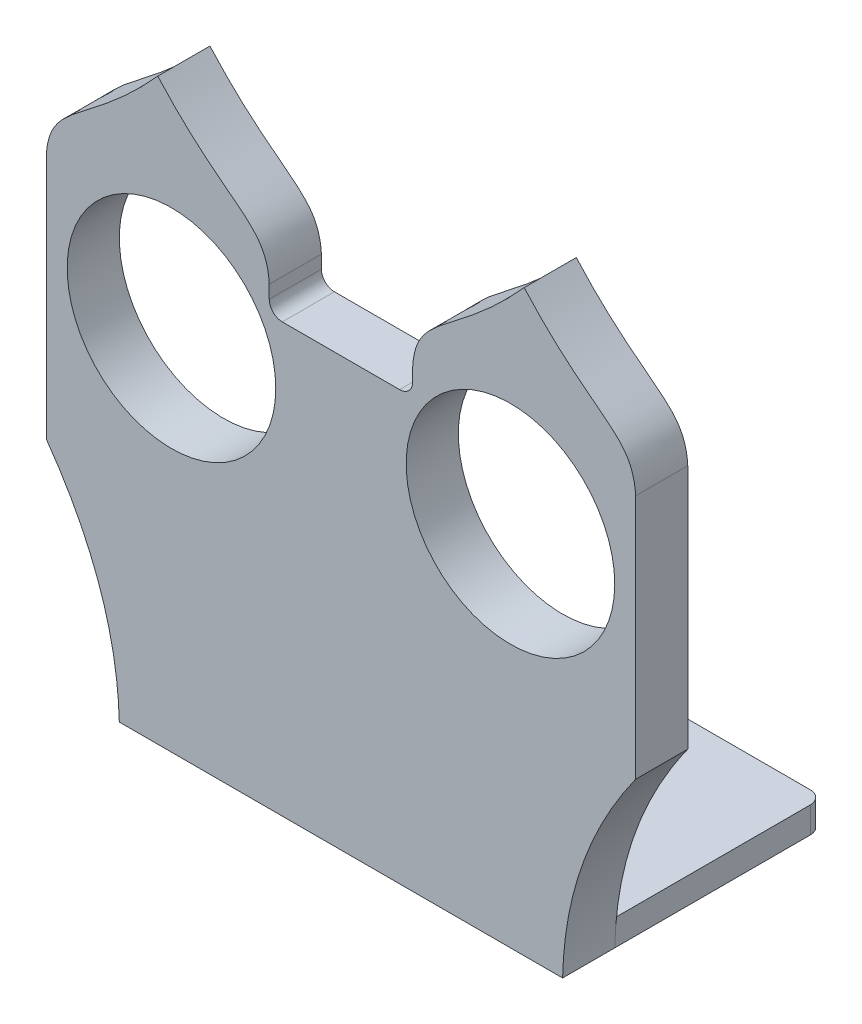
from build123d import *

# Parameters (mm, degrees)
SKETCH_1_R           = 8
EXTRUDE_2_DEPTH      = 2
EXTRUDE_3_DEPTH      = 18
EXTRUDE_3_DEPTH_BACK = 1
SKETCH_2_W           = 45.2
SKETCH_2_H           = 2
SKETCH_3_W           = 45.2
SKETCH_3_H           = 18
EXTRUDE_4_DEPTH      = 18
SKETCH_4_W           = 45.2
SKETCH_4_H           = 18
CUT_EXTRUDE_2_DEPTH  = 16
CUT_EXTRUDE_4_DEPTH  = 20
SKETCH_7_W           = 0.117046
SKETCH_7_H           = 18
CUT_EXTRUDE_5_DEPTH  = 20
CUT_EXTRUDE_6_DEPTH  = 20
SKETCH_9_R           = 0.5
CUT_EXTRUDE_7_DEPTH  = 20
CUT_EXTRUDE_8_DEPTH  = 20
FILLET_1_R           = 1
FILLET_2_R           = 1
FILLET_3_R           = 1
SKETCH_14_W          = 47.954779
SKETCH_14_H          = 7.292093
CUT_EXTRUDE_12_DEPTH = 4
EXTRUDE_START        = -4
EXTRUDE_11_OUTLINE_R = 8
EXTRUDE_11_DEPTH     = 4


# Read off the part's stored shape, not the designer's step: 凸台-拉伸11
with BuildPart() as part:
    # 草图1 → 凸台-拉伸2 (new body)
    with BuildSketch(Plane.XY):
        with BuildLine():
            Line((1, 0), (44.2, 0))
            ThreePointArc((44.2, 0), (44.907107, 0.292893), (45.2, 1))
            Line((45.2, 1), (45.2, 19.33))
            ThreePointArc((45.2, 19.33), (44.907107, 20.037107), (44.2, 20.33))
            Line((44.2, 20.33), (1, 20.33))
            ThreePointArc((1, 20.33), (0.292893, 20.037107), (0, 19.33))
            Line((0, 19.33), (0, 1))
            ThreePointArc((0, 1), (0.292893, 0.292893), (1, 0))
        make_face()
        with Locations((35.6, 10.165)):
            Circle(SKETCH_1_R, mode=Mode.SUBTRACT)
        with Locations((9.6, 10.165)):
            Circle(SKETCH_1_R, mode=Mode.SUBTRACT)
    extrude(amount=EXTRUDE_2_DEPTH)

    # 草图2 → 凸台-拉伸3 (add, two sides: drawn at the far end of the back side and taken through both)
    with BuildSketch(Plane.XZ.offset(-EXTRUDE_3_DEPTH_BACK)):
        with Locations((22.6, 1)):
            Rectangle(SKETCH_2_W, SKETCH_2_H)
    extrude(amount=EXTRUDE_3_DEPTH + EXTRUDE_3_DEPTH_BACK)

    # 草图3 → 凸台-拉伸4 (add)
    with BuildSketch(Plane(origin=(0, 0, 0), x_dir=(-1, 0, 0), z_dir=(0, 0, -1))):
        with Locations((-22.6, -9)):
            Rectangle(SKETCH_3_W, SKETCH_3_H)
    extrude(amount=EXTRUDE_4_DEPTH)

    # 草图4 → 切除-拉伸2 (cut)
    with BuildSketch(Plane(origin=(0, 0, 0), x_dir=(1, 0, 0), z_dir=(0, 1, 0))):
        with Locations((22.6, 9)):
            Rectangle(SKETCH_4_W, SKETCH_4_H)
    extrude(amount=-CUT_EXTRUDE_2_DEPTH, mode=Mode.SUBTRACT)

    # 草图5 → 切除-拉伸4 (cut)
    with BuildSketch(Plane.XY.offset(2)):
        Polygon((0, -18), (5.6, -18), (0, -2), align=None)
        with BuildLine():
            Line((0, -2), (5.6, -18))
            add(Edge.make_bspline(
                [(0, -2), (5.393134, -9.559308), (5.6, -18)],
                knots=[0, 0, 0, 0.926119, 0.926119, 0.926119], degree=2))
        make_face()
        with BuildLine():
            add(Edge.make_bspline(
                [(45.2, -2), (39.778817, -9.554541), (39.6, -18)],
                knots=[0, 0, 0, 0.936137, 0.936137, 0.936137], degree=2))
            Line((39.6, -18), (45.2, -18))
            Line((45.2, -18), (45.2, -2))
        make_face()
    extrude(amount=-CUT_EXTRUDE_4_DEPTH, mode=Mode.SUBTRACT)

    # 草图7 → 切除-拉伸5 (cut)
    with BuildSketch(Plane(origin=(0, -18, 0), x_dir=(-1, 0, 0), z_dir=(0, -1, 0))):
        with Locations((-39.658523, 9)):
            Rectangle(SKETCH_7_W, SKETCH_7_H)
    extrude(amount=-CUT_EXTRUDE_5_DEPTH, mode=Mode.SUBTRACT)

    # 草图8 → 切除-拉伸6 (cut)
    with BuildSketch(Plane(origin=(0, -18, 0), x_dir=(-1, 0, 0), z_dir=(0, -1, 0))):
        with BuildLine():
            ThreePointArc((-39.6, 17), (-39.307107, 17.707107), (-38.6, 18))
            Line((-38.6, 18), (-39.6, 18))
            Line((-39.6, 18), (-39.6, 17))
        make_face()
        with BuildLine():
            ThreePointArc((-6.6, 18), (-5.892893, 17.707107), (-5.6, 17))
            Line((-5.6, 17), (-5.6, 18))
            Line((-5.6, 18), (-6.6, 18))
        make_face()
        Polygon((-5.6, 0), (-5.476967, 0), (-5.476967, 18), (-5.6, 18), (-5.6, 17), align=None)
    extrude(amount=-CUT_EXTRUDE_6_DEPTH, mode=Mode.SUBTRACT)

    # 草图9 → 切除-拉伸7 (cut)
    with BuildSketch(Plane.XZ.offset(18)):
        with Locations(Location((16.35, -9, 0), (0, 0, 270))):
            Circle(SKETCH_9_R)
        with Locations(Location((22.6, -2.75, 0), (0, 0, 270))):
            Circle(SKETCH_9_R)
        with Locations(Location((28.85, -9, 0), (0, 0, 270))):
            Circle(SKETCH_9_R)
        with Locations(Location((22.6, -15.25, 0), (0, 0, 270))):
            Circle(SKETCH_9_R)
    extrude(amount=-CUT_EXTRUDE_7_DEPTH, mode=Mode.SUBTRACT)

    # 草图10 → 切除-拉伸8 (cut)
    with BuildSketch(Plane.XY.offset(2)):
        Polygon((22.6, 20.33), (17.1, 20.33), (17.1, 14.83), (28.1, 14.83), (28.1, 20.33), align=None)
    extrude(amount=-CUT_EXTRUDE_8_DEPTH, mode=Mode.SUBTRACT)

    # 圆角1
    fillet_1_edges = [part.edges().sort_by_distance(p)[0] for p in [
        (28.1, 20.33, 1),
        (17.1, 20.33, 1),
    ]]
    fillet(fillet_1_edges, radius=FILLET_1_R)

    # 圆角2
    fillet_2_edges = [part.edges().sort_by_distance(p)[0] for p in [
        (28.1, 14.83, 1),
    ]]
    fillet(fillet_2_edges, radius=FILLET_2_R)

    # 圆角3
    fillet_3_edges = [part.edges().sort_by_distance(p)[0] for p in [
        (17.1, 14.83, 1),
    ]]
    fillet(fillet_3_edges, radius=FILLET_3_R)

    # 草图14 → 切除-拉伸12 (cut)
    with BuildSketch(Plane(origin=(0, 20.33, 0), x_dir=(1, 0, 0), z_dir=(0, 1, 0))):
        with Locations((22.880684, -2.280867)):
            Rectangle(SKETCH_14_W, SKETCH_14_H)
    extrude(amount=-CUT_EXTRUDE_12_DEPTH, mode=Mode.SUBTRACT)

    # 凸台-拉伸11 outline → 凸台-拉伸11 (add)
    with BuildSketch(Plane.XY.offset(2).offset(EXTRUDE_START)):
        with BuildLine():
            add(Edge.make_bspline(
                [(0, -2), (5.393134, -9.559308), (5.6, -18)],
                knots=[0, 0, 0, 0.926119, 0.926119, 0.926119], degree=2))
            Line((5.6, -18), (5.6, -16))
            Line((5.6, -16), (39.6, -16))
            Line((39.6, -16), (39.6, -18))
            add(Edge.make_bspline(
                [(45.2, -2), (39.778817, -9.554541), (39.6, -18)],
                knots=[0, 0, 0, 0.936137, 0.936137, 0.936137], degree=2))
            Line((45.2, -2), (45.2, 16.83))
            add(Edge.make_bspline(
                [(36.65, 26.38), (41.993745, 20.411254), (44.982894, 20.749172), (45.2, 16.83)],
                knots=[0, 0, 0, 0, 0.927631, 0.927631, 0.927631, 0.927631], degree=3))
            add(Edge.make_bspline(
                [(36.65, 26.38), (31.306253, 20.41125), (28.317106, 20.749171), (28.1, 16.83)],
                knots=[0, 0, 0, 0, 0.927631, 0.927631, 0.927631, 0.927631], degree=3))
            Line((28.1, 16.83), (28.1, 15.83))
            ThreePointArc((28.1, 15.83), (27.807107, 15.122893), (27.1, 14.83))
            Line((27.1, 14.83), (18.1, 14.83))
            ThreePointArc((18.1, 14.83), (17.392893, 15.122893), (17.1, 15.83))
            Line((17.1, 15.83), (17.1, 16.83))
            add(Edge.make_bspline(
                [(8.55, 26.38), (13.893745, 20.411254), (16.882894, 20.749172), (17.1, 16.83)],
                knots=[0, 0, 0, 0, 0.927631, 0.927631, 0.927631, 0.927631], degree=3))
            add(Edge.make_bspline(
                [(8.55, 26.38), (3.206253, 20.41125), (0.217106, 20.749171), (0, 16.83)],
                knots=[0, 0, 0, 0, 0.927631, 0.927631, 0.927631, 0.927631], degree=3))
            Line((0, 16.83), (0, -2))
        make_face()
        with Locations((9.6, 10.165)):
            Circle(EXTRUDE_11_OUTLINE_R, mode=Mode.SUBTRACT)
        with Locations((35.6, 10.165)):
            Circle(EXTRUDE_11_OUTLINE_R, mode=Mode.SUBTRACT)
    extrude(amount=EXTRUDE_11_DEPTH)


solid = part.part
